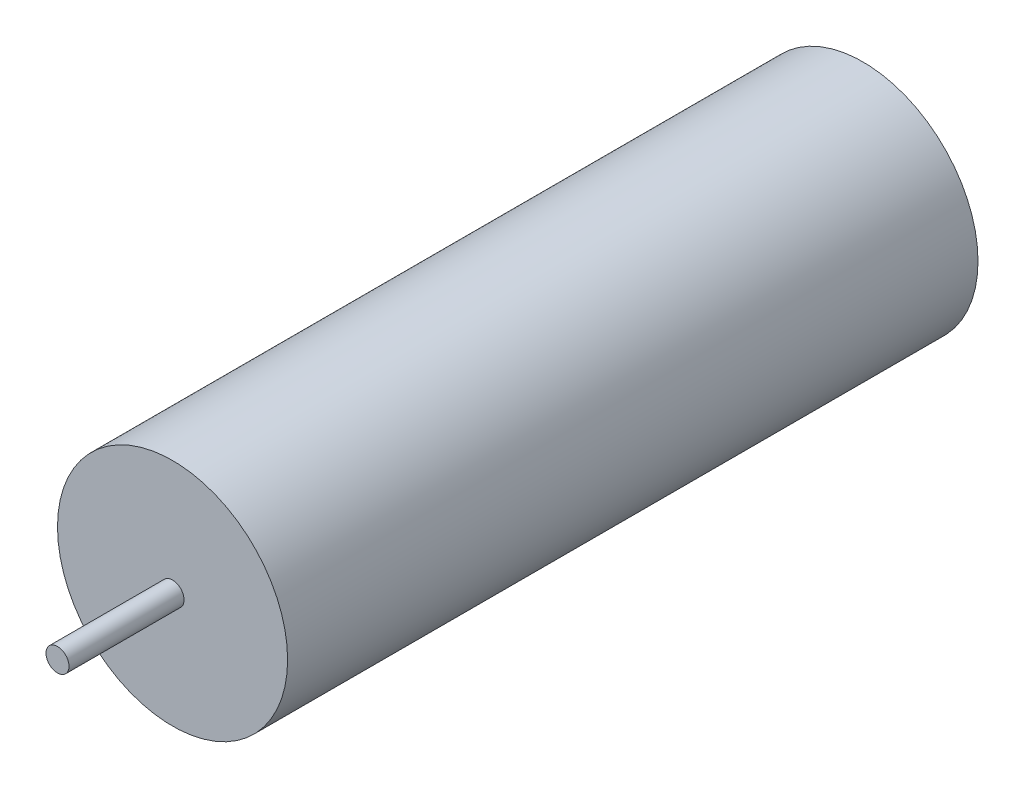
from build123d import *

# Parameters (mm, degrees)
SKETCH1_R           = 12.7
BOSS_EXTRUDE1_DEPTH = 76.2
SKETCH2_R           = 1.27
BOSS_EXTRUDE2_DEPTH = 12.7


with BuildPart() as part:
    # Sketch1 → Boss-Extrude1 (new body)
    with BuildSketch(Plane.XY):
        with Locations((0, -25.4)):
            Circle(SKETCH1_R)
    extrude(amount=-BOSS_EXTRUDE1_DEPTH)

    # Sketch2 → Boss-Extrude2 (add)
    with BuildSketch(Plane.XY):
        with Locations((0, -25.4)):
            Circle(SKETCH2_R)
    extrude(amount=BOSS_EXTRUDE2_DEPTH)


solid = part.part
